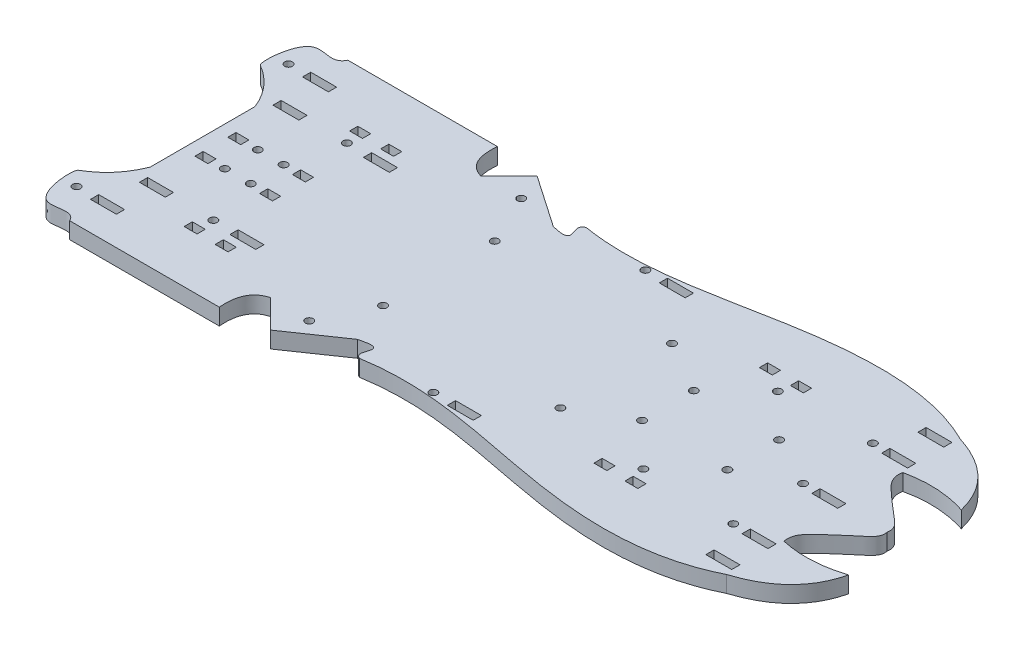
from build123d import *

# Parameters (mm, degrees)
BOSS_EXTRUDE1_DEPTH = 6.35
SKETCH3_R           = 1.5
SKETCH3_W           = 10
SKETCH3_H           = 3.175
CUT_EXTRUDE1_DEPTH  = 158.184313073
SKETCH5_W           = 5
SKETCH5_H           = 3.175
CUT_EXTRUDE2_DEPTH  = 158.184313073
SKETCH6_R           = 1.5
CUT_EXTRUDE3_DEPTH  = 158.184313073
SKETCH7_R           = 1.5
SKETCH7_W           = 10
SKETCH7_H           = 3.175
CUT_EXTRUDE4_DEPTH  = 158.184313073
SKETCH8_R           = 1.5
SKETCH8_W           = 5
SKETCH8_H           = 3.175
CUT_EXTRUDE5_DEPTH  = 158.184313073


with BuildPart() as part:
    # Sketch2 → Boss-Extrude1 (new body)
    with BuildSketch(Plane(origin=(0, 0, 0), x_dir=(1, 0, 0), z_dir=(0, 1, 0))):
        with BuildLine():
            Line((-63.840406603, 53.785068799), (-121.703241026, 53.785068799))
            add(Edge.make_bspline(
                [(-121.703241026, 53.785068799), (-123.819920355, 49.210083175), (-137.241691881, 58.423533423), (-138.26369047, 36.423372022), (-136.998583021, 35.221213289)],
                knots=[0, 0, 0, 0, 0.398285644, 1, 1, 1, 1], degree=3))
            add(Edge.make_bspline(
                [(-136.998583021, 35.221213289), (-127.88549748, 29.911265708), (-124.104675839, 20.253417254)],
                knots=[0, 0, 0, 1, 1, 1], degree=2))
            Line((-124.104675839, 20.253417254), (-124.104675839, -20.253417254))
            add(Edge.make_bspline(
                [(-136.998583021, -35.221213289), (-127.88549748, -29.911265708), (-124.104675839, -20.253417254)],
                knots=[0, 0, 0, 1, 1, 1], degree=2))
            add(Edge.make_bspline(
                [(-121.703241026, -53.785068799), (-123.819920355, -49.210083175), (-137.241691881, -58.423533423), (-138.26369047, -36.423372022), (-136.998583021, -35.221213289)],
                knots=[0, 0, 0, 0, 0.398285644, 1, 1, 1, 1], degree=3))
            Line((-121.703241026, -53.785068799), (-63.840406603, -53.785068799))
            add(Edge.make_bspline(
                [(-57.115781708, -40.699265908), (-64.807976148, -42.813184771), (-63.840406603, -53.785068799)],
                knots=[0, 0, 0, 1, 1, 1], degree=2))
            Line((-57.115781708, -40.699265908), (-46.309635168, -51.597792498))
            Line((-46.309635168, -51.597792498), (-26.261962572, -37.823631127))
            add(Edge.make_bspline(
                [(-19.55447883, -43.838791847), (-24.344879992, -42.167651215), (-14.250336762, -34.782636199), (-26.261962572, -37.823631127)],
                knots=[0, 0, 0, 0, 1, 1, 1, 1], degree=3))
            add(Edge.make_bspline(
                [(123.757273008, -45.270242074), (104.087590493, -55.130079971), (53.546875396, -54.438380733), (7.18703234, -39.374307215), (-19.55447883, -43.838791847)],
                knots=[0, 0, 0, 0, 0.449954768, 1, 1, 1, 1], degree=3))
            add(Edge.make_bspline(
                [(147.559317256, -21.799462681), (143.472760055, -38.985173762), (123.757273008, -45.270242074)],
                knots=[0, 0, 0, 1, 1, 1], degree=2))
            add(Edge.make_bspline(
                [(123.757273008, -22.991351993), (135.666095504, -25.641892918), (147.559317256, -21.799462681)],
                knots=[0, 0, 0, 1, 1, 1], degree=2))
            add(Edge.make_bspline(
                [(140.662042739, 0), (141.38719629, -2.761069346), (135.736494125, -7.354188949), (128.693355786, -13.506295653), (122.935458325, -18.932494165), (123.757273008, -22.991351993)],
                knots=[0, 0, 0, 0, 0.249977057, 0.654822336, 1, 1, 1, 1], degree=3))
            add(Edge.make_bspline(
                [(140.662042739, 0), (141.38719629, 2.761069346), (135.736494125, 7.354188949), (128.693355786, 13.506295653), (122.935458325, 18.932494165), (123.757273008, 22.991351993)],
                knots=[0, 0, 0, 0, 0.249977057, 0.654822336, 1, 1, 1, 1], degree=3))
            add(Edge.make_bspline(
                [(123.757273008, 22.991351993), (135.666095504, 25.641892918), (147.559317256, 21.799462681)],
                knots=[0, 0, 0, 1, 1, 1], degree=2))
            add(Edge.make_bspline(
                [(147.559317256, 21.799462681), (143.472760055, 38.985173762), (123.757273008, 45.270242074)],
                knots=[0, 0, 0, 1, 1, 1], degree=2))
            add(Edge.make_bspline(
                [(123.757273008, 45.270242074), (104.087590493, 55.130079971), (53.546875396, 54.438380733), (7.18703234, 39.374307215), (-19.55447883, 43.838791847)],
                knots=[0, 0, 0, 0, 0.449954768, 1, 1, 1, 1], degree=3))
            add(Edge.make_bspline(
                [(-19.55447883, 43.838791847), (-24.344879992, 42.167651215), (-14.250336762, 34.782636199), (-26.261962572, 37.823631127)],
                knots=[0, 0, 0, 0, 1, 1, 1, 1], degree=3))
            Line((-26.261962572, 37.823631127), (-46.309635168, 51.597792498))
            Line((-46.309635168, 51.597792498), (-57.115781708, 40.699265908))
            add(Edge.make_bspline(
                [(-57.115781708, 40.699265908), (-64.807976148, 42.813184771), (-63.840406603, 53.785068799)],
                knots=[0, 0, 0, 1, 1, 1], degree=2))
        make_face()
    extrude(amount=BOSS_EXTRUDE1_DEPTH)

    # Sketch3 → Cut-Extrude1 (cut, through all)
    with BuildSketch(Plane(origin=(0, 6.35, 0), x_dir=(1, 0, 0), z_dir=(0, 1, 0))):
        with Locations((6.160337598, 41)):
            Circle(SKETCH3_R)
        with Locations((-41.839662402, 41)):
            Circle(SKETCH3_R)
        with Locations((-131.839662402, 41)):
            Circle(SKETCH3_R)
        with Locations((6.160337598, -41)):
            Circle(SKETCH3_R)
        with Locations((-41.839662402, -41)):
            Circle(SKETCH3_R)
        with Locations((-131.839662402, -41)):
            Circle(SKETCH3_R)
        with Locations((108.160337598, 27)):
            Circle(SKETCH3_R)
        with Locations((108.160337598, 0)):
            Circle(SKETCH3_R)
        with Locations((108.160337598, -27)):
            Circle(SKETCH3_R)
        with Locations((118.160337598, 41)):
            Rectangle(SKETCH3_W, SKETCH3_H)
        with Locations((18.160337598, 41)):
            Rectangle(SKETCH3_W, SKETCH3_H)
        with Locations((-119.839662402, 41)):
            Rectangle(SKETCH3_W, SKETCH3_H)
        with Locations((-119.839662402, -41)):
            Rectangle(SKETCH3_W, SKETCH3_H)
        with Locations((18.160337598, -41)):
            Rectangle(SKETCH3_W, SKETCH3_H)
        with Locations((118.160337598, -41)):
            Rectangle(SKETCH3_W, SKETCH3_H)
        with Locations((118.160337598, 0)):
            Rectangle(SKETCH3_W, SKETCH3_H)
        with Locations((118.160337598, 27)):
            Rectangle(SKETCH3_W, SKETCH3_H)
        with Locations((118.160337598, -27)):
            Rectangle(SKETCH3_W, SKETCH3_H)
    extrude(amount=-CUT_EXTRUDE1_DEPTH, mode=Mode.SUBTRACT)

    # Sketch5 → Cut-Extrude2 (cut, through all)
    with BuildSketch(Plane(origin=(0, 6.35, 0), x_dir=(1, 0, 0), z_dir=(0, 1, 0))):
        with Locations((63.360337601, 32)):
            Rectangle(SKETCH5_W, SKETCH5_H)
        with Locations((75.360337601, 32)):
            Rectangle(SKETCH5_W, SKETCH5_H)
        with Locations((-95.134675839, 32)):
            Rectangle(SKETCH5_W, SKETCH5_H)
        with Locations((-83.134675839, 32)):
            Rectangle(SKETCH5_W, SKETCH5_H)
        with Locations((75.360337601, -32)):
            Rectangle(SKETCH5_W, SKETCH5_H)
        with Locations((63.360337601, -32)):
            Rectangle(SKETCH5_W, SKETCH5_H)
        with Locations((-83.134675839, -32)):
            Rectangle(SKETCH5_W, SKETCH5_H)
        with Locations((-95.134675839, -32)):
            Rectangle(SKETCH5_W, SKETCH5_H)
    extrude(amount=-CUT_EXTRUDE2_DEPTH, mode=Mode.SUBTRACT)

    # Sketch6 → Cut-Extrude3 (cut, through all)
    with BuildSketch(Plane(origin=(0, 6.35, 0), x_dir=(1, 0, 0), z_dir=(0, 1, 0))):
        with Locations((55.895324161, 10)):
            Circle(SKETCH6_R)
        with Locations((88.895324161, 10)):
            Circle(SKETCH6_R)
        with Locations((72.395324161, 26)):
            Circle(SKETCH6_R)
        with Locations((88.895324161, -10)):
            Circle(SKETCH6_R)
        with Locations((55.895324161, -10)):
            Circle(SKETCH6_R)
        with Locations((72.395324161, -26)):
            Circle(SKETCH6_R)
        with Locations((35.895324161, 21.59)):
            Circle(SKETCH6_R)
        with Locations((35.895324161, -21.59)):
            Circle(SKETCH6_R)
        with Locations((-32.684675839, -21.59)):
            Circle(SKETCH6_R)
        with Locations((-32.684675839, 21.59)):
            Circle(SKETCH6_R)
    extrude(amount=-CUT_EXTRUDE3_DEPTH, mode=Mode.SUBTRACT)

    # Sketch7 → Cut-Extrude4 (cut, through all)
    with BuildSketch(Plane(origin=(0, 6.35, 0), x_dir=(1, 0, 0), z_dir=(0, 1, 0))):
        with Locations((-94.104675839, 25.825)):
            Circle(SKETCH7_R)
        with Locations((-94.104675839, -25.825)):
            Circle(SKETCH7_R)
        with Locations((-116.104675839, 25.825)):
            Rectangle(SKETCH7_W, SKETCH7_H)
        with Locations((-81.104675839, 25.825)):
            Rectangle(SKETCH7_W, SKETCH7_H)
        with Locations((-81.104675839, -25.825)):
            Rectangle(SKETCH7_W, SKETCH7_H)
        with Locations((-116.104675839, -25.825)):
            Rectangle(SKETCH7_W, SKETCH7_H)
    extrude(amount=-CUT_EXTRUDE4_DEPTH, mode=Mode.SUBTRACT)

    # Sketch8 → Cut-Extrude5 (cut, through all)
    with BuildSketch(Plane(origin=(0, 6.35, 0), x_dir=(1, 0, 0), z_dir=(0, 1, 0))):
        with Locations((-109.104675839, 6.35)):
            Circle(SKETCH8_R)
        with Locations((-99.104675839, 6.35)):
            Circle(SKETCH8_R)
        with Locations((-99.104675839, -6.35)):
            Circle(SKETCH8_R)
        with Locations((-109.104675839, -6.35)):
            Circle(SKETCH8_R)
        with Locations((-116.604675839, 6.35)):
            Rectangle(SKETCH8_W, SKETCH8_H)
        with Locations((-91.604675839, 6.35)):
            Rectangle(SKETCH8_W, SKETCH8_H)
        with Locations((-91.604675839, -6.35)):
            Rectangle(SKETCH8_W, SKETCH8_H)
        with Locations((-116.604675839, -6.35)):
            Rectangle(SKETCH8_W, SKETCH8_H)
    extrude(amount=-CUT_EXTRUDE5_DEPTH, mode=Mode.SUBTRACT)


solid = part.part
